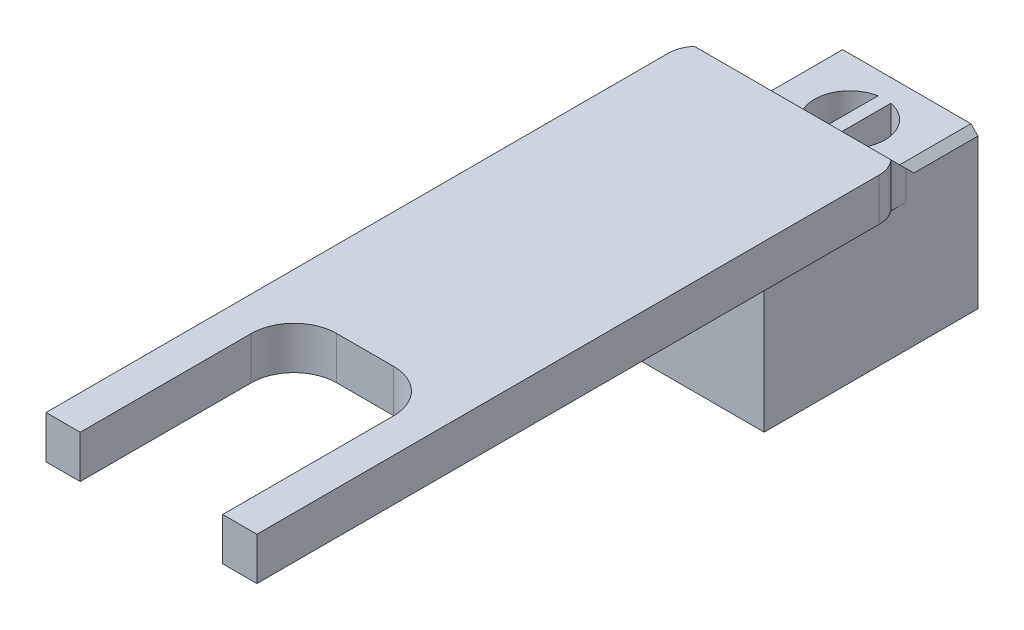
from build123d import *

# Parameters (mm, degrees)
SKETCH1_W           = 12.7
SKETCH1_H           = 19.05
BOSS_EXTRUDE1_DEPTH = 13.97
SKETCH2_W           = 12.7
SKETCH2_H           = 8.89
BOSS_EXTRUDE2_DEPTH = 3.81
CHAMFER3_SIZE       = 3.81
CHAMFER5_SIZE       = 2.54
FILLET1_R           = 3.81
FILLET2_R           = 3.81
FILLET3_R           = 2.54
CHAMFER6_SIZE       = 0.635


with BuildPart() as part:
    # Sketch1 → Boss-Extrude1 (new body)
    with BuildSketch(Plane(origin=(0, 0, 0), x_dir=(1, 0, 0), z_dir=(0, 1, 0))):
        with Locations((6.35, -9.525)):
            Rectangle(SKETCH1_W, SKETCH1_H)
        with BuildLine():
            Line((5.7785, -1.989141169), (5.7785, -8.170858831))
            ThreePointArc((5.7785, -8.170858831), (3.20675, -5.08), (5.7785, -1.989141169))
        make_face(mode=Mode.SUBTRACT)
        with BuildLine():
            ThreePointArc((6.9215, -1.989141169), (9.49325, -5.08), (6.9215, -8.170858831))
            Line((6.9215, -8.170858831), (6.9215, -1.989141169))
        make_face(mode=Mode.SUBTRACT)
    extrude(amount=BOSS_EXTRUDE1_DEPTH)

    # Sketch2 → Boss-Extrude2 (add)
    with BuildSketch(Plane(origin=(0, 13.97, 0), x_dir=(1, 0, 0), z_dir=(0, 1, 0))):
        Polygon((0, -10.16), (-3.048, -10.16), (-3.048, -67.31), (0, -67.31), (0, -48.26), (12.7, -48.26), (12.7, -67.31), (15.748, -67.31), (15.748, -10.16), (12.7, -10.16), (12.7, -19.05), (0, -19.05), align=None)
        with Locations((6.35, -14.605)):
            Rectangle(SKETCH2_W, SKETCH2_H)
    extrude(amount=BOSS_EXTRUDE2_DEPTH)

    # Chamfer3
    # the kernel refuses this chamfer: 3.81 mm, written as the material it adds along each edge
    with BuildSketch(Plane(origin=(12.7, 13.97, 10.16), x_dir=(0, -0.027495876610586382, -0.9996219169112968), z_dir=(-1, 0, 0))) as chamfer3_piece_1_section:
        Polygon((CHAMFER3_SIZE * 0.999621916911, -CHAMFER3_SIZE * 0.0274958766106), (-CHAMFER3_SIZE * 0.0274958766106, -CHAMFER3_SIZE * 0.999621916911), (0, 0), align=None)
    chamfer3_piece_1 = extrude(amount=12.7, mode=Mode.PRIVATE)
    chamfer3_piece_1 = chamfer3_piece_1 - Plane(origin=(6.35, 15.278434863, 5.08), x_dir=(-0.18181818181819312, 0, 0.9833321660356314), z_dir=(0, -1, 0)) * Cylinder(3.14325, 41, mode=Mode.PRIVATE)
    add(chamfer3_piece_1)
    with BuildSketch(Plane(origin=(22.498112184, 13.97, 10.16), x_dir=(0, -0.027495876610586382, -0.9996219169112968), z_dir=(-1, 0, 0))) as chamfer3_piece_2_section:
        Polygon((CHAMFER3_SIZE * 0.999621916911, -CHAMFER3_SIZE * 0.0274958766106), (-CHAMFER3_SIZE * 0.0274958766106, -CHAMFER3_SIZE * 0.999621916911), (0, 0), align=None)
    chamfer3_piece_2 = extrude(amount=32.296224368, mode=Mode.PRIVATE)
    chamfer3_piece_2 = split(chamfer3_piece_2, bisect_by=Plane(origin=(5.7785, 14.588702158, 7.587404322), z_dir=(1, 0, 0)), keep=Keep.TOP, mode=Mode.PRIVATE)
    chamfer3_piece_2 = split(chamfer3_piece_2, bisect_by=Plane(origin=(6.9215, 14.588702158, 7.587404322), z_dir=(-1, 0, 0)), keep=Keep.TOP, mode=Mode.PRIVATE)
    add(chamfer3_piece_2)

    # Chamfer5
    chamfer5_edges = [part.edges().sort_by_distance(p)[0] for p in [
        (6.35, 13.97, 19.05),
        (12.7, 13.97, 14.605),
        (0, 13.97, 14.605),
    ]]
    chamfer(chamfer5_edges, length=CHAMFER5_SIZE)

    # Fillet1
    fillet1_edges = [part.edges().sort_by_distance(p)[0] for p in [
        (0, 15.875, 48.26),
        (12.7, 15.875, 48.26),
    ]]
    fillet(fillet1_edges, radius=FILLET1_R)

    # Fillet2
    # the kernel refuses this fillet: 3.81 mm, written as the material it adds along each edge
    with BuildSketch(Plane(origin=(0, 2.09744408, 10.16), x_dir=(-1.0, 0, -1.5694648846796446e-12), z_dir=(0, 1, 0))) as fillet2_piece_1_section:
        with BuildLine():
            CenterArc((3.81, -3.733022368), FILLET2_R, 101.536959033, 78.463040967)
            Line((0, -3.733022368), (-0.0762, -3.733022368))
            Line((-0.0762, -3.733022368), (-0.0762, 0))
            Line((-0.0762, 0), (0, 0.0762))
            ThreePointArc((0, 0.0762), (1.524, 0.0762), (3.03276, 0.074660447))
            Line((3.03276, 0.074660447), (3.048, 0))
        make_face()
    fillet2_piece_1 = extrude(amount=15.68255592, mode=Mode.PRIVATE)
    fillet2_piece_1 = split(fillet2_piece_1, bisect_by=Plane(origin=(-0.488499052, 13.97, 9.10243743), z_dir=(0, -1, 0)), keep=Keep.TOP, mode=Mode.PRIVATE)
    fillet2_piece_1 = split(fillet2_piece_1, bisect_by=Plane(origin=(-1.001374289, 12.431374289, 9.10243743), z_dir=(0.7071067811865477, 0.7071067811865475, 0)), keep=Keep.TOP, mode=Mode.PRIVATE)
    add(fillet2_piece_1)
    with BuildSketch(Plane(origin=(0, 2.09744408, 10.16), x_dir=(-1.0, 0, -1.5694648846796446e-12), z_dir=(0, 1, 0))) as fillet2_piece_2_section:
        with BuildLine():
            CenterArc((3.81, -3.733022368), FILLET2_R, 101.536959033, 78.463040967)
            Line((0, -3.733022368), (-0.0762, -3.733022368))
            Line((-0.0762, -3.733022368), (-0.0762, 0))
            Line((-0.0762, 0), (0, 0.0762))
            ThreePointArc((0, 0.0762), (1.524, 0.0762), (3.03276, 0.074660447))
            Line((3.03276, 0.074660447), (3.048, 0))
        make_face()
    fillet2_piece_2 = extrude(amount=15.68255592, mode=Mode.PRIVATE)
    fillet2_piece_2 = split(fillet2_piece_2, bisect_by=Plane(origin=(-2.842111613, 13.97, 10.172095318), z_dir=(0, 1, 0)), keep=Keep.TOP, mode=Mode.PRIVATE)
    fillet2_piece_2 = split(fillet2_piece_2, bisect_by=Plane(origin=(-2.766583712, 14.196583712, 10.172095318), z_dir=(-0.7071067811865477, -0.7071067811865475, 0)), keep=Keep.TOP, mode=Mode.PRIVATE)
    add(fillet2_piece_2)
    with BuildSketch(Plane(origin=(0, 2.09744408, 10.16), x_dir=(-1.0, 0, -1.5694648846796446e-12), z_dir=(0, 1, 0))) as fillet2_piece_3_section:
        with BuildLine():
            CenterArc((3.81, -3.733022368), FILLET2_R, 101.536959033, 78.463040967)
            Line((0, -3.733022368), (-0.0762, -3.733022368))
            Line((-0.0762, -3.733022368), (-0.0762, 0))
            Line((-0.0762, 0), (0, 0.0762))
            ThreePointArc((0, 0.0762), (1.524, 0.0762), (3.03276, 0.074660447))
            Line((3.03276, 0.074660447), (3.048, 0))
        make_face()
    fillet2_piece_3 = extrude(amount=15.68255592, mode=Mode.PRIVATE)
    fillet2_piece_3 = split(fillet2_piece_3, bisect_by=Plane(origin=(-0.871394664, 13.97, 9.510267837), z_dir=(0, 1, 0)), keep=Keep.TOP, mode=Mode.PRIVATE)
    fillet2_piece_3 = split(fillet2_piece_3, bisect_by=Plane(origin=(-2.496213957, 13.926213957, 9.510267837), z_dir=(0.7071067811865477, 0.7071067811865475, 0)), keep=Keep.TOP, mode=Mode.PRIVATE)
    fillet2_piece_3 = split(fillet2_piece_3, bisect_by=Plane(origin=(-0.871394664, 16.340650543, 8.720650543), z_dir=(0, -0.7071067811862648, 0.7071067811868302)), keep=Keep.TOP, mode=Mode.PRIVATE)
    add(fillet2_piece_3)
    with BuildSketch(Plane(origin=(12.7, 17.78, 10.16), x_dir=(1.0, 0, -1.0525263949987076e-12), z_dir=(0, -1, 0))) as fillet2_piece_4_section:
        with BuildLine():
            CenterArc((3.81, -3.733022368), FILLET2_R, 101.536959033, 78.463040967)
            Line((0, -3.733022368), (-0.0762, -3.733022368))
            Line((-0.0762, -3.733022368), (-0.0762, 0))
            Line((-0.0762, 0), (0, 0.0762))
            ThreePointArc((0, 0.0762), (1.524, 0.0762), (3.03276, 0.074660447))
            Line((3.03276, 0.074660447), (3.048, 0))
        make_face()
    fillet2_piece_4 = extrude(amount=15.68255592, mode=Mode.PRIVATE)
    fillet2_piece_4 = split(fillet2_piece_4, bisect_by=Plane(origin=(13.571394664, 13.97, 9.510267837), z_dir=(0, 1, 0)), keep=Keep.TOP, mode=Mode.PRIVATE)
    fillet2_piece_4 = split(fillet2_piece_4, bisect_by=Plane(origin=(15.196213957, 13.926213957, 9.510267837), z_dir=(-0.7071067811865479, 0.7071067811865474, 0)), keep=Keep.TOP, mode=Mode.PRIVATE)
    fillet2_piece_4 = split(fillet2_piece_4, bisect_by=Plane(origin=(13.571394664, 16.340650543, 8.720650543), z_dir=(0, -0.7071067811862648, 0.7071067811868302)), keep=Keep.TOP, mode=Mode.PRIVATE)
    add(fillet2_piece_4)
    with BuildSketch(Plane(origin=(12.7, 17.78, 10.16), x_dir=(1.0, 0, -1.0525263949987076e-12), z_dir=(0, -1, 0))) as fillet2_piece_5_section:
        with BuildLine():
            CenterArc((3.81, -3.733022368), FILLET2_R, 101.536959033, 78.463040967)
            Line((0, -3.733022368), (-0.0762, -3.733022368))
            Line((-0.0762, -3.733022368), (-0.0762, 0))
            Line((-0.0762, 0), (0, 0.0762))
            ThreePointArc((0, 0.0762), (1.524, 0.0762), (3.03276, 0.074660447))
            Line((3.03276, 0.074660447), (3.048, 0))
        make_face()
    fillet2_piece_5 = extrude(amount=15.68255592, mode=Mode.PRIVATE)
    fillet2_piece_5 = split(fillet2_piece_5, bisect_by=Plane(origin=(13.188499052, 13.97, 9.10243743), z_dir=(0, -1, 0)), keep=Keep.TOP, mode=Mode.PRIVATE)
    fillet2_piece_5 = split(fillet2_piece_5, bisect_by=Plane(origin=(13.701374289, 12.431374289, 9.10243743), z_dir=(-0.7071067811865479, 0.7071067811865474, 0)), keep=Keep.TOP, mode=Mode.PRIVATE)
    add(fillet2_piece_5)
    with BuildSketch(Plane(origin=(12.7, 17.78, 10.16), x_dir=(1.0, 0, -1.0525263949987076e-12), z_dir=(0, -1, 0))) as fillet2_piece_6_section:
        with BuildLine():
            CenterArc((3.81, -3.733022368), FILLET2_R, 101.536959033, 78.463040967)
            Line((0, -3.733022368), (-0.0762, -3.733022368))
            Line((-0.0762, -3.733022368), (-0.0762, 0))
            Line((-0.0762, 0), (0, 0.0762))
            ThreePointArc((0, 0.0762), (1.524, 0.0762), (3.03276, 0.074660447))
            Line((3.03276, 0.074660447), (3.048, 0))
        make_face()
    fillet2_piece_6 = extrude(amount=15.68255592, mode=Mode.PRIVATE)
    fillet2_piece_6 = split(fillet2_piece_6, bisect_by=Plane(origin=(15.542111613, 13.97, 10.172095318), z_dir=(0, 1, 0)), keep=Keep.TOP, mode=Mode.PRIVATE)
    fillet2_piece_6 = split(fillet2_piece_6, bisect_by=Plane(origin=(15.466583712, 14.196583712, 10.172095318), z_dir=(0.7071067811865479, -0.7071067811865474, 0)), keep=Keep.TOP, mode=Mode.PRIVATE)
    add(fillet2_piece_6)

    # Fillet3
    fillet3_edges = [part.edges().sort_by_distance(p)[0] for p in [
        (-3.048, 15.875, 10.16),
        (15.748, 15.875, 10.16),
    ]]
    fillet(fillet3_edges, radius=FILLET3_R)

    # Chamfer6
    chamfer6_edges = [part.edges().sort_by_distance(p)[0] for p in [
        (12.7, 13.97, 3.175),
        (0, 13.97, 3.175),
    ]]
    chamfer(chamfer6_edges, length=CHAMFER6_SIZE)


solid = part.part
